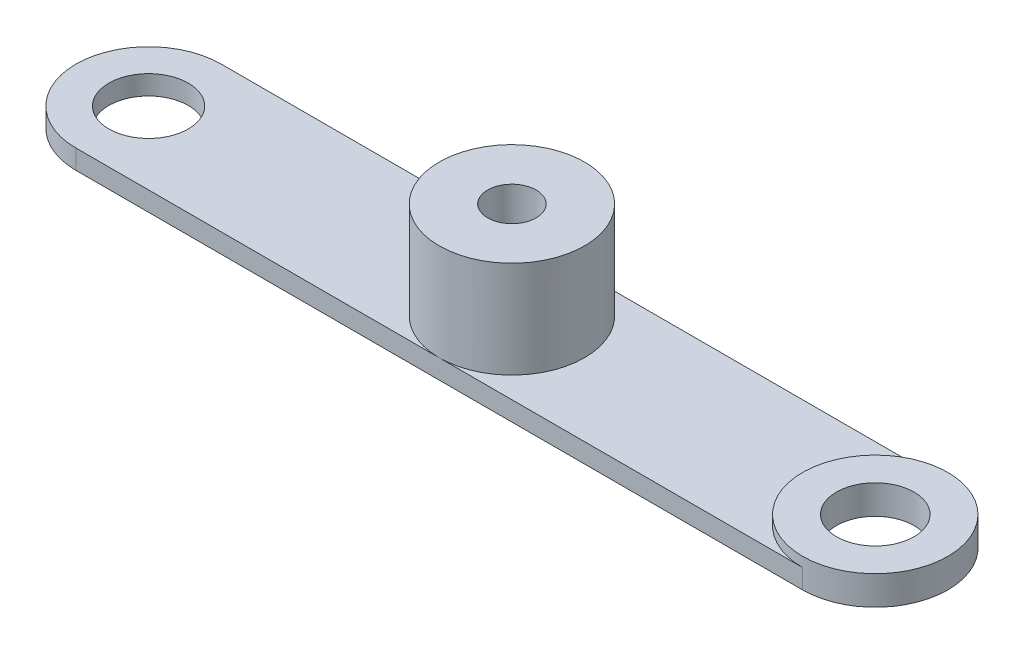
from build123d import *
from build123d.topology import SkipClean

# Parameters (mm, degrees)
SKETCH1_R           = 4.1
SKETCH1_R_2         = 4
BOSS_EXTRUDE1_DEPTH = 2
SKETCH3_R           = 7.5
BOSS_EXTRUDE3_DEPTH = 10
SKETCH4_R           = 2.5
CUT_EXTRUDE1_DEPTH  = 48.172555581
SKETCH5_R           = 7.5
SKETCH5_R_2         = 4
BOSS_EXTRUDE4_DEPTH = 1


with BuildPart() as part:
    # Sketch1 → Boss-Extrude1 (new body)
    with BuildSketch(Plane(origin=(0, 0, 0), x_dir=(1, 0, 0), z_dir=(0, 1, 0))):
        with BuildLine():
            Line((-37.5, 7.5), (37.5, 7.5))
            ThreePointArc((37.5, 7.5), (45, 0), (37.5, -7.5))
            Line((37.5, -7.5), (-37.5, -7.5))
            ThreePointArc((-37.5, -7.5), (-45, 0), (-37.5, 7.5))
        make_face()
        with Locations((-37.5, 0)):
            Circle(SKETCH1_R, mode=Mode.SUBTRACT)
        with Locations((37.5, 0)):
            Circle(SKETCH1_R_2, mode=Mode.SUBTRACT)
    extrude(amount=BOSS_EXTRUDE1_DEPTH)

    # Sketch3 → Boss-Extrude3 (add)
    with BuildSketch(Plane(origin=(0, 2, 0), x_dir=(1, 0, 0), z_dir=(0, 1, 0))):
        Circle(SKETCH3_R)
    extrude(amount=BOSS_EXTRUDE3_DEPTH)

    # Sketch4 → Cut-Extrude1 (cut, through all)
    with BuildSketch(Plane(origin=(0, 12, 0), x_dir=(1, 0, 0), z_dir=(0, 1, 0))):
        Circle(SKETCH4_R)
    extrude(amount=-CUT_EXTRUDE1_DEPTH, mode=Mode.SUBTRACT)

    # Sketch5 → Boss-Extrude4 (add)
    with SkipClean():  # the faces are left unmerged after this step: merging them gives an invalid solid
        with BuildSketch(Plane(origin=(0, 2, 0), x_dir=(1, 0, 0), z_dir=(0, 1, 0))):
            with Locations((37.5, 0)):
                Circle(SKETCH5_R)
            with Locations((37.5, 0)):
                Circle(SKETCH5_R_2, mode=Mode.SUBTRACT)
        extrude(amount=BOSS_EXTRUDE4_DEPTH)
    add(part.part.scale(1), mode=Mode.REPLACE)  # the faces are merged on a copy


solid = part.part
